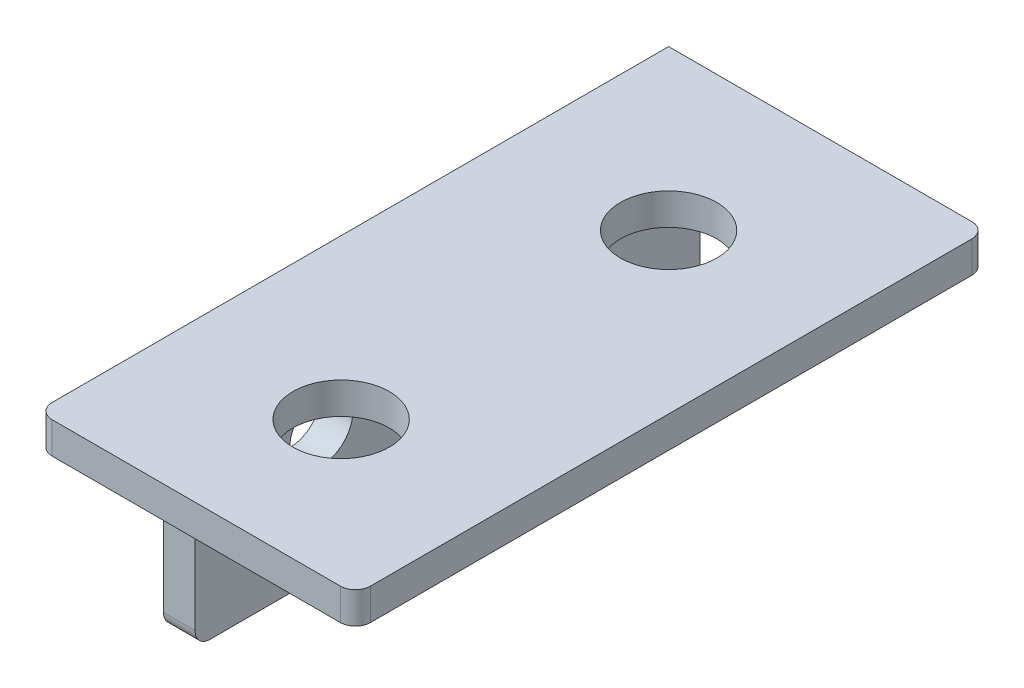
from build123d import *

# Parameters (mm, degrees)
SKETCH2_W           = 50.8
SKETCH2_H           = 25.4
BOSS_EXTRUDE1_DEPTH = 3.175
SKETCH4_W           = 32
SKETCH4_H           = 63.5
BOSS_EXTRUDE2_DEPTH = 3.175
SKETCH6_R           = 3.175
CUT_EXTRUDE2_DEPTH  = 3.175
BOSS_EXTRUDE3_DEPTH = 1.5875
SKETCH8_R           = 4.85
CUT_EXTRUDE3_DEPTH  = 10
FILLET3_R           = 1.5


with BuildPart() as part:
    # Sketch2 → Boss-Extrude1 (new body)
    with BuildSketch(Plane(origin=(0, 0, 0), x_dir=(0, 0, -1), z_dir=(1, 0, 0))):
        Rectangle(SKETCH2_W, SKETCH2_H)
    extrude(amount=BOSS_EXTRUDE1_DEPTH)

    # Sketch4 → Boss-Extrude2 (add)
    with BuildSketch(Plane(origin=(0, 12.7, 0), x_dir=(1, 0, 0), z_dir=(0, 1, 0))):
        with Locations((16, -6.35)):
            Rectangle(SKETCH4_W, SKETCH4_H)
    extrude(amount=-BOSS_EXTRUDE2_DEPTH)

    # Sketch6 → Cut-Extrude2 (cut)
    with BuildSketch(Plane.ZY):
        with Locations((-12.7, 0)):
            Circle(SKETCH6_R)
        with Locations((12.7, 0)):
            Circle(SKETCH6_R)
    extrude(amount=-CUT_EXTRUDE2_DEPTH, mode=Mode.SUBTRACT)

    # Sketch7 → Boss-Extrude3 (add, symmetric)
    with BuildSketch(Plane.XY):
        Polygon((3.175, -12.7), (25.4, 9.525), (3.175, 9.525), align=None)
    extrude(amount=BOSS_EXTRUDE3_DEPTH, both=True)

    # Sketch8 → Cut-Extrude3 (cut)
    with BuildSketch(Plane(origin=(0, 12.7, 0), x_dir=(1, 0, 0), z_dir=(0, 1, 0))):
        with Locations(Location((16, 9.4, 0), (0, 0, 270))):
            Circle(SKETCH8_R)
        with Locations(Location((16, -23.536231777, 0), (0, 0, 270))):
            Circle(SKETCH8_R)
    extrude(amount=-CUT_EXTRUDE3_DEPTH, mode=Mode.SUBTRACT)

    # Fillet3
    # the kernel refuses this fillet: 1.5 mm, written as the material it adds along each edge
    with BuildSketch(Plane(origin=(4.675, 8.025, 3.0875), x_dir=(0, 0, -1), z_dir=(-1, 0, 0))) as fillet3_piece_1_section:
        Polygon((0, 0), (FILLET3_R, 0), (FILLET3_R, -FILLET3_R), (0, -FILLET3_R), align=None)
    fillet3_piece_1 = extrude(amount=FILLET3_R, mode=Mode.PRIVATE)
    fillet3_piece_1 = fillet3_piece_1 - Plane(origin=(4.675, 8.025, 3.0875), x_dir=(0, -0.7071067811865475, 0.7071067811865475), z_dir=(-1, 0, 0)) * Sphere(FILLET3_R, mode=Mode.PRIVATE)
    add(fillet3_piece_1)
    with BuildSketch(Plane(origin=(4.675, 8.025, -3.0875), x_dir=(-1, 0, 0), z_dir=(0, 0, 1))) as fillet3_piece_2_section:
        Polygon((0, 0), (FILLET3_R, 0), (FILLET3_R, -FILLET3_R), (0, -FILLET3_R), align=None)
    fillet3_piece_2 = extrude(amount=FILLET3_R, mode=Mode.PRIVATE)
    fillet3_piece_2 = fillet3_piece_2 - Plane(origin=(4.675, 8.025, -3.0875), x_dir=(0.7071067811865475, -0.7071067811865475, 0), z_dir=(0, 0, 1)) * Sphere(FILLET3_R, mode=Mode.PRIVATE)
    add(fillet3_piece_2)
    with BuildSketch(Plane(origin=(3.175, 9.525, 25.4), x_dir=(0, -1, 0), z_dir=(-1, 0, 0))) as fillet3_piece_3:
        with BuildLine():
            CenterArc((FILLET3_R, FILLET3_R), FILLET3_R, 180, 90)
            Line((0, FILLET3_R), (0, 0))
            Line((0, 0), (FILLET3_R, 0))
        make_face()
    extrude(amount=3.175)
    with BuildSketch(Plane(origin=(3.175, 9.525, 25.4), x_dir=(0, -1, 0), z_dir=(0, 0, -1)), Plane(origin=(3.175, 9.525, -3.0875), x_dir=(0, -1, 0), z_dir=(0, 0, -1))) as fillet3_piece_4:
        with BuildLine():
            CenterArc((FILLET3_R, -FILLET3_R), FILLET3_R, 90, 90)
            Line((0, -FILLET3_R), (0, 0))
            Line((0, 0), (FILLET3_R, 0))
        make_face()
    extrude(amount=22.3125)
    with BuildSketch(Plane(origin=(29.15, 9.525, -1.5875), x_dir=(0, 0, -1), z_dir=(-1, 0, 0))) as fillet3_piece_5_section:
        with BuildLine():
            CenterArc((FILLET3_R, FILLET3_R), FILLET3_R, 180, 90)
            Line((0, FILLET3_R), (0, 0))
            Line((0, 0), (FILLET3_R, 0))
        make_face()
    fillet3_piece_5 = extrude(amount=24.475, mode=Mode.PRIVATE)
    fillet3_piece_5 = split(fillet3_piece_5, bisect_by=Plane(origin=(19.967902823, 4.092902823, -1.930123153), z_dir=(-0.707106781186549, 0.707106781186546, 0)), keep=Keep.TOP, mode=Mode.PRIVATE)
    add(fillet3_piece_5)
    with BuildSketch(Plane(origin=(25.4, 9.525, -1.5875), x_dir=(-0.7071067811865489, -0.7071067811865461, 0), z_dir=(0, 0, 1))) as fillet3_piece_6:
        with BuildLine():
            CenterArc((FILLET3_R * 0.414213562373, FILLET3_R), FILLET3_R, 225, 45)
            Line((-FILLET3_R * 0.292893218813, FILLET3_R * 0.292893218813), (0, 0))
            Line((0, 0), (FILLET3_R * 0.414213562373, 0))
        make_face()
    extrude(amount=3.175)
    with BuildSketch(Plane(origin=(3.175, 8.025, -1.5875), x_dir=(0, 0, -1), z_dir=(0, -1, 0))) as fillet3_piece_7_section:
        with BuildLine():
            CenterArc((FILLET3_R, FILLET3_R), FILLET3_R, 180, 90)
            Line((0, FILLET3_R), (0, 0))
            Line((0, 0), (FILLET3_R, 0))
        make_face()
    fillet3_piece_7 = extrude(amount=20.725, mode=Mode.PRIVATE)
    fillet3_piece_7 = split(fillet3_piece_7, bisect_by=Plane(origin=(8.60741784, -7.26758216, -1.930100054), z_dir=(-0.707106781186549, 0.707106781186546, 0)), keep=Keep.TOP, mode=Mode.PRIVATE)
    add(fillet3_piece_7)
    with BuildSketch(Plane(origin=(29.15, 9.525, 1.5875), x_dir=(0, 0, 1), z_dir=(-1, 0, 0))) as fillet3_piece_8_section:
        with BuildLine():
            CenterArc((FILLET3_R, -FILLET3_R), FILLET3_R, 90, 90)
            Line((0, -FILLET3_R), (0, 0))
            Line((0, 0), (FILLET3_R, 0))
        make_face()
    fillet3_piece_8 = extrude(amount=24.475, mode=Mode.PRIVATE)
    fillet3_piece_8 = split(fillet3_piece_8, bisect_by=Plane(origin=(19.967902823, 4.092902823, 1.930123153), z_dir=(-0.707106781186549, 0.707106781186546, 0)), keep=Keep.TOP, mode=Mode.PRIVATE)
    add(fillet3_piece_8)
    with BuildSketch(Plane(origin=(3.175, 8.025, 1.5875), x_dir=(0, 0, 1), z_dir=(0, -1, 0))) as fillet3_piece_9_section:
        with BuildLine():
            CenterArc((FILLET3_R, -FILLET3_R), FILLET3_R, 90, 90)
            Line((0, -FILLET3_R), (0, 0))
            Line((0, 0), (FILLET3_R, 0))
        make_face()
    fillet3_piece_9 = extrude(amount=20.725, mode=Mode.PRIVATE)
    fillet3_piece_9 = split(fillet3_piece_9, bisect_by=Plane(origin=(8.60741784, -7.26758216, 1.930100054), z_dir=(-0.707106781186549, 0.707106781186546, 0)), keep=Keep.TOP, mode=Mode.PRIVATE)
    add(fillet3_piece_9)
    with BuildSketch(Plane(origin=(6.925, 9.525, 25.4), x_dir=(0, -1, 0), z_dir=(-1, 0, 0))) as fillet3_piece_10a_section:
        with BuildLine():
            CenterArc((FILLET3_R, FILLET3_R), FILLET3_R, 180, 90)
            Line((0, FILLET3_R), (0, 0))
            Line((0, 0), (FILLET3_R, 0))
        make_face()
    fillet3_piece_10a = extrude(amount=6.925, mode=Mode.PRIVATE)
    fillet3_piece_10a = split(fillet3_piece_10a, bisect_by=Plane(origin=(3.175, 9.185407329, 25.739592671), z_dir=(1, 0, 0)), keep=Keep.TOP, mode=Mode.PRIVATE)
    with BuildSketch(Plane(origin=(3.175, 9.525, 29.15), x_dir=(0, -1, 0), z_dir=(0, 0, -1))) as fillet3_piece_10b_section:
        with BuildLine():
            CenterArc((FILLET3_R, -FILLET3_R), FILLET3_R, 90, 90)
            Line((0, -FILLET3_R), (0, 0))
            Line((0, 0), (FILLET3_R, 0))
        make_face()
    fillet3_piece_10b = extrude(amount=26.0625, mode=Mode.PRIVATE)
    fillet3_piece_10b = split(fillet3_piece_10b, bisect_by=Plane(origin=(3.514592671, 9.185407329, 25.4), z_dir=(0, 0, 1)), keep=Keep.TOP, mode=Mode.PRIVATE)
    fillet3_piece_10 = fillet3_piece_10a & fillet3_piece_10b
    add(fillet3_piece_10)
    with BuildSketch(Plane(origin=(25.4, 9.525, -3.140800859), x_dir=(-0.7071067811865446, -0.7071067811865503, 0), z_dir=(0, 0, 1))) as fillet3_piece_11a_section:
        with BuildLine():
            CenterArc((FILLET3_R * 0.414213562373, FILLET3_R), FILLET3_R, 225, 45)
            Line((-FILLET3_R * 0.292893218813, FILLET3_R * 0.292893218813), (0, 0))
            Line((0, 0), (FILLET3_R * 0.414213562373, 0))
        make_face()
    fillet3_piece_11a = extrude(amount=4.728300859, mode=Mode.PRIVATE)
    fillet3_piece_11a = split(fillet3_piece_11a, bisect_by=Plane(origin=(25.438403899, 9.432284787, -1.5875), z_dir=(0, 0, -1)), keep=Keep.TOP, mode=Mode.PRIVATE)
    with BuildSketch(Plane(origin=(29.15, 9.525, -1.5875), x_dir=(0, 0, -1), z_dir=(-1, 0, 0))) as fillet3_piece_11b_section:
        with BuildLine():
            CenterArc((FILLET3_R, FILLET3_R), FILLET3_R, 180, 90)
            Line((0, FILLET3_R), (0, 0))
            Line((0, 0), (FILLET3_R, 0))
        make_face()
    fillet3_piece_11b = extrude(amount=24.475, mode=Mode.PRIVATE)
    fillet3_piece_11b = split(fillet3_piece_11b, bisect_by=Plane(origin=(26.063627713, 10.188627713, -1.91198662), z_dir=(0.707106781186549, -0.707106781186546, 0)), keep=Keep.TOP, mode=Mode.PRIVATE)
    fillet3_piece_11 = fillet3_piece_11a & fillet3_piece_11b
    add(fillet3_piece_11)
    with BuildSketch(Plane(origin=(25.4, 9.525, -1.5875), x_dir=(-0.7071067811865489, -0.7071067811865461, 0), z_dir=(0, 0, 1))) as fillet3_piece_12a_section:
        with BuildLine():
            CenterArc((FILLET3_R * 0.414213562373, FILLET3_R), FILLET3_R, 225, 45)
            Line((-FILLET3_R * 0.292893218813, FILLET3_R * 0.292893218813), (0, 0))
            Line((0, 0), (FILLET3_R * 0.414213562373, 0))
        make_face()
    fillet3_piece_12a = extrude(amount=4.728300859, mode=Mode.PRIVATE)
    fillet3_piece_12a = split(fillet3_piece_12a, bisect_by=Plane(origin=(25.438403899, 9.432284787, 1.5875), z_dir=(0, 0, 1)), keep=Keep.TOP, mode=Mode.PRIVATE)
    with BuildSketch(Plane(origin=(29.15, 9.525, 1.5875), x_dir=(0, 0, 1), z_dir=(-1, 0, 0))) as fillet3_piece_12b_section:
        with BuildLine():
            CenterArc((FILLET3_R, -FILLET3_R), FILLET3_R, 90, 90)
            Line((0, -FILLET3_R), (0, 0))
            Line((0, 0), (FILLET3_R, 0))
        make_face()
    fillet3_piece_12b = extrude(amount=24.475, mode=Mode.PRIVATE)
    fillet3_piece_12b = split(fillet3_piece_12b, bisect_by=Plane(origin=(26.063627713, 10.188627713, 1.91198662), z_dir=(0.707106781186549, -0.707106781186546, 0)), keep=Keep.TOP, mode=Mode.PRIVATE)
    fillet3_piece_12 = fillet3_piece_12a & fillet3_piece_12b
    add(fillet3_piece_12)
    # the kernel refuses this fillet: 1.5 mm, written as the material it takes off along each edge
    with BuildSketch(Plane(origin=(0, 16.45, 38.1), x_dir=(0, 0, -1), z_dir=(0, -1, 0)), Plane(origin=(32, 16.45, -25.4), x_dir=(0, 0, 1), z_dir=(0, -1, 0)), Plane(origin=(-3.75, -12.7, 25.4), x_dir=(0, 0, -1), z_dir=(1, 0, 0))) as fillet3_2_piece_1:
        with BuildLine():
            CenterArc((FILLET3_R, FILLET3_R), FILLET3_R, 180, 90)
            Line((0, FILLET3_R), (0, 0))
            Line((0, 0), (FILLET3_R, 0))
        make_face()
    extrude(amount=10.675, mode=Mode.SUBTRACT)
    with BuildSketch(Plane(origin=(32, 16.45, 38.1), x_dir=(0, 0, -1), z_dir=(0, -1, 0)), Plane(origin=(-3.75, -12.7, -25.4), x_dir=(0, 0, 1), z_dir=(1, 0, 0))) as fillet3_2_piece_2:
        with BuildLine():
            CenterArc((FILLET3_R, -FILLET3_R), FILLET3_R, 90, 90)
            Line((0, -FILLET3_R), (0, 0))
            Line((0, 0), (FILLET3_R, 0))
        make_face()
    extrude(amount=10.675, mode=Mode.SUBTRACT)


solid = part.part
